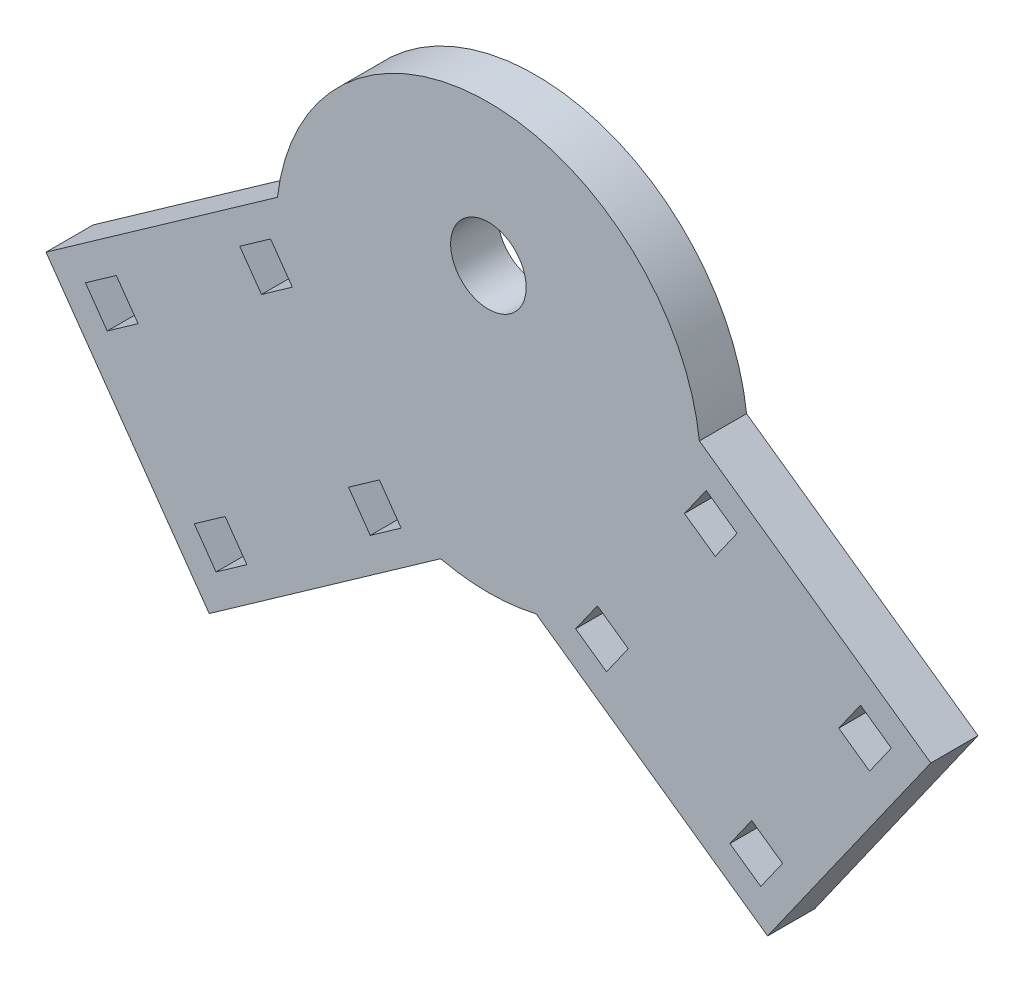
from build123d import *

# Parameters (mm, degrees)
SKETCH2_R           = 22.5
SKETCH2_R_2         = 4
BOSS_EXTRUDE1_DEPTH = 5
CUT_EXTRUDE1_DEPTH  = 10


with BuildPart() as part:
    # Sketch2 → Boss-Extrude1 (new body)
    # profile 1 of 3: a face of its own
    with BuildSketch(Plane.XY):
        Circle(SKETCH2_R)
        with Locations((0, 7.5)):
            Circle(SKETCH2_R_2, mode=Mode.SUBTRACT)
    # profile 2 of 3: a face of its own
    with BuildSketch(Plane.XY):
        Polygon((5.061398723, -21.923326458), (22.349954637, 2.594133329), (46.867414424, -14.694422585), (29.57885851, -39.211882372), align=None)
    # profile 3 of 3: a face of its own
    with BuildSketch(Plane.XY):
        Polygon((-5.061398723, -21.923326458), (-22.349954637, 2.594133329), (-46.867414424, -14.694422585), (-29.57885851, -39.211882372), align=None)
    extrude(amount=BOSS_EXTRUDE1_DEPTH)

    # Sketch4 → Cut-Extrude1 (cut)
    with BuildSketch(Plane.XY.offset(5)):
        Polygon((-42.686812854, -15.417312972), (-39.417818215, -13.112172184), (-37.112677427, -16.381166822), (-40.381672065, -18.68630761), align=None)
        Polygon((-31.161108911, -31.762286163), (-27.892114273, -29.457145375), (-25.586973484, -32.726140013), (-28.855968122, -35.031280802), align=None)
        Polygon((-11.547141081, -17.931441432), (-14.81613572, -20.236582221), (-12.510994931, -23.505576859), (-9.242000293, -21.20043607), align=None)
        Polygon((-26.341839662, -3.891609029), (-23.072845024, -1.586468241), (-20.767704236, -4.855462879), (-24.036698874, -7.160603668), align=None)
        Polygon((23.072845024, -1.586468241), (26.341839662, -3.891609029), (24.036698874, -7.160603668), (20.767704236, -4.855462879), align=None)
        Polygon((37.112677427, -16.381166822), (39.417818215, -13.112172184), (42.686812854, -15.417312972), (40.381672065, -18.68630761), align=None)
        Polygon((27.892114273, -29.457145375), (31.161108911, -31.762286163), (28.855968122, -35.031280802), (25.586973484, -32.726140013), align=None)
        Polygon((11.547141081, -17.931441432), (14.81613572, -20.236582221), (12.510994931, -23.505576859), (9.242000293, -21.20043607), align=None)
    extrude(amount=-CUT_EXTRUDE1_DEPTH, mode=Mode.SUBTRACT)


solid = part.part
